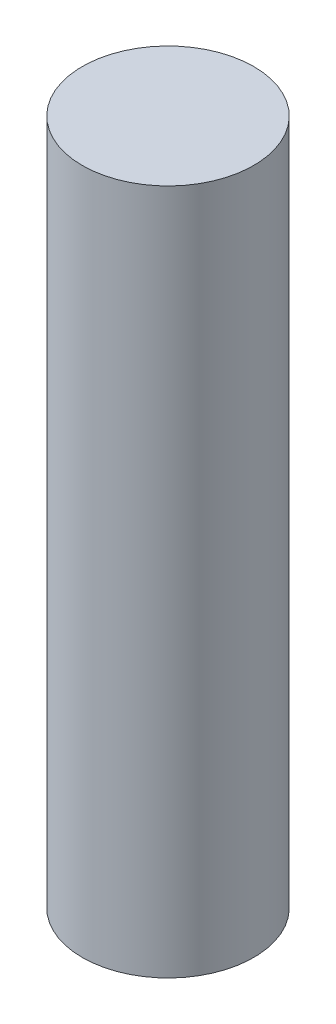
from build123d import *

# Parameters (mm, degrees)
BOSS_EXTRUDE1_DEPTH      = 20
BOSS_EXTRUDE1_DEPTH_BACK = 20
SKETCH1_R                = 5


with BuildPart() as part:
    # Sketch1 → Boss-Extrude1 (new, two sides: drawn at the far end of the back side and taken through both)
    with BuildSketch(Plane(origin=(0, 0, 0), x_dir=(1, 0, 0), z_dir=(0, 1, 0)).offset(-BOSS_EXTRUDE1_DEPTH_BACK)):
        Circle(SKETCH1_R)
    extrude(amount=BOSS_EXTRUDE1_DEPTH + BOSS_EXTRUDE1_DEPTH_BACK)


solid = part.part
